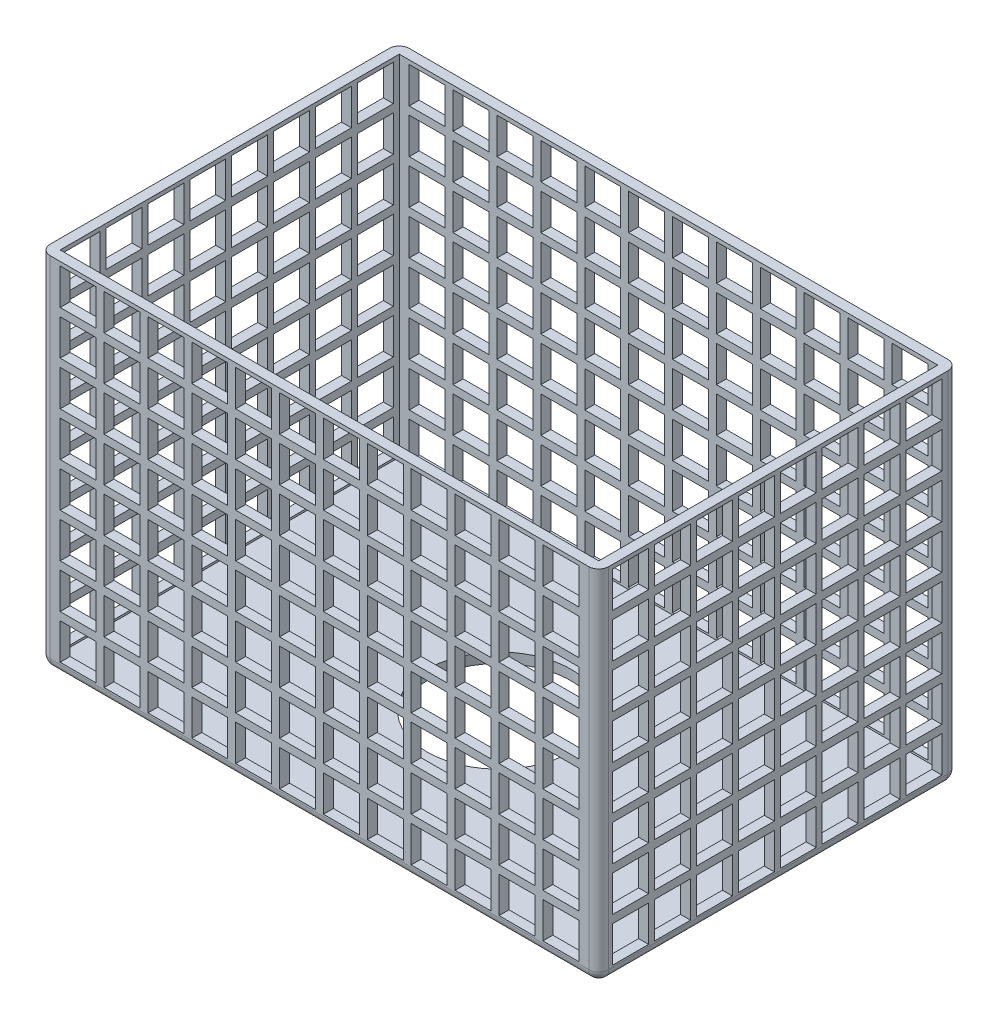
from build123d import *

# Parameters (mm, degrees)
SKETCH_1_W          = 280
SKETCH_1_H          = 180
EXTRUDE_1_DEPTH     = 180
FILLET_1_R          = 5
SHELL_START         = -135
SHELL_1_OUTLINE_W   = 175
SHELL_1_OUTLINE_H   = 170
SHELL_1_DEPTH       = 270
SKETCH_4_W          = 18
SKETCH_4_H          = 18
CUT_EXTRUDE_3_DEPTH = 246.153013443
SKETCH_5_W          = 18
SKETCH_5_H          = 18
CUT_EXTRUDE_4_DEPTH = 345.818792991
SKETCH_6_R          = 36
CUT_EXTRUDE_5_DEPTH = 288.445647036


# Read off the part's stored shape, not the designer's step: 抽壳1
with BuildPart() as part:
    # 草图1 → 凸台-拉伸1 (new body)
    with BuildSketch(Plane.XY):
        Rectangle(SKETCH_1_W, SKETCH_1_H)
    extrude(amount=EXTRUDE_1_DEPTH)

    # 圆角1
    fillet_1_edges = [part.edges().sort_by_distance(p)[0] for p in [
        (-140, 0, 180),
        (0, -90, 180),
        (140, 0, 180),
        (0, -90, 0),
        (-140, 0, 0),
        (140, 0, 0),
        (140, -90, 90),
        (-140, -90, 90),
    ]]
    fillet(fillet_1_edges, radius=FILLET_1_R)

    # 抽壳1 outline → 抽壳1 (cut)
    with BuildSketch(Plane.YZ.offset(SHELL_START)):
        with Locations((2.5, 90)):
            Rectangle(SHELL_1_OUTLINE_W, SHELL_1_OUTLINE_H)
    extrude(amount=SHELL_1_DEPTH, mode=Mode.SUBTRACT)

    # 草图4 → 切除-拉伸3 (cut, through all)
    with BuildSketch(Plane(origin=(0, 0, 0), x_dir=(-1, 0, 0), z_dir=(0, 0, -1))):
        with Locations((-121, 79)):
            Rectangle(SKETCH_4_W, SKETCH_4_H)
        with Locations((-99, 79)):
            Rectangle(SKETCH_4_W, SKETCH_4_H)
        with Locations((-77, 79)):
            Rectangle(SKETCH_4_W, SKETCH_4_H)
        with Locations((-55, 79)):
            Rectangle(SKETCH_4_W, SKETCH_4_H)
        with Locations((-33, 79)):
            Rectangle(SKETCH_4_W, SKETCH_4_H)
        with Locations((-11, 79)):
            Rectangle(SKETCH_4_W, SKETCH_4_H)
        with Locations((11, 79)):
            Rectangle(SKETCH_4_W, SKETCH_4_H)
        with Locations((33, 79)):
            Rectangle(SKETCH_4_W, SKETCH_4_H)
        with Locations((55, 79)):
            Rectangle(SKETCH_4_W, SKETCH_4_H)
        with Locations((77, 79)):
            Rectangle(SKETCH_4_W, SKETCH_4_H)
        with Locations((99, 79)):
            Rectangle(SKETCH_4_W, SKETCH_4_H)
        with Locations((121, 79)):
            Rectangle(SKETCH_4_W, SKETCH_4_H)
        with Locations((-99, 57)):
            Rectangle(SKETCH_4_W, SKETCH_4_H)
        with Locations((-77, 57)):
            Rectangle(SKETCH_4_W, SKETCH_4_H)
        with Locations((-55, 57)):
            Rectangle(SKETCH_4_W, SKETCH_4_H)
        with Locations((-33, 57)):
            Rectangle(SKETCH_4_W, SKETCH_4_H)
        with Locations((-11, 57)):
            Rectangle(SKETCH_4_W, SKETCH_4_H)
        with Locations((11, 57)):
            Rectangle(SKETCH_4_W, SKETCH_4_H)
        with Locations((33, 57)):
            Rectangle(SKETCH_4_W, SKETCH_4_H)
        with Locations((55, 57)):
            Rectangle(SKETCH_4_W, SKETCH_4_H)
        with Locations((77, 57)):
            Rectangle(SKETCH_4_W, SKETCH_4_H)
        with Locations((99, 57)):
            Rectangle(SKETCH_4_W, SKETCH_4_H)
        with Locations((121, 57)):
            Rectangle(SKETCH_4_W, SKETCH_4_H)
        with Locations((-99, 35)):
            Rectangle(SKETCH_4_W, SKETCH_4_H)
        with Locations((-77, 35)):
            Rectangle(SKETCH_4_W, SKETCH_4_H)
        with Locations((-55, 35)):
            Rectangle(SKETCH_4_W, SKETCH_4_H)
        with Locations((-33, 35)):
            Rectangle(SKETCH_4_W, SKETCH_4_H)
        with Locations((-11, 35)):
            Rectangle(SKETCH_4_W, SKETCH_4_H)
        with Locations((11, 35)):
            Rectangle(SKETCH_4_W, SKETCH_4_H)
        with Locations((33, 35)):
            Rectangle(SKETCH_4_W, SKETCH_4_H)
        with Locations((55, 35)):
            Rectangle(SKETCH_4_W, SKETCH_4_H)
        with Locations((77, 35)):
            Rectangle(SKETCH_4_W, SKETCH_4_H)
        with Locations((99, 35)):
            Rectangle(SKETCH_4_W, SKETCH_4_H)
        with Locations((121, 35)):
            Rectangle(SKETCH_4_W, SKETCH_4_H)
        with Locations((-99, 13)):
            Rectangle(SKETCH_4_W, SKETCH_4_H)
        with Locations((-77, 13)):
            Rectangle(SKETCH_4_W, SKETCH_4_H)
        with Locations((-55, 13)):
            Rectangle(SKETCH_4_W, SKETCH_4_H)
        with Locations((-33, 13)):
            Rectangle(SKETCH_4_W, SKETCH_4_H)
        with Locations((-11, 13)):
            Rectangle(SKETCH_4_W, SKETCH_4_H)
        with Locations((11, 13)):
            Rectangle(SKETCH_4_W, SKETCH_4_H)
        with Locations((33, 13)):
            Rectangle(SKETCH_4_W, SKETCH_4_H)
        with Locations((55, 13)):
            Rectangle(SKETCH_4_W, SKETCH_4_H)
        with Locations((77, 13)):
            Rectangle(SKETCH_4_W, SKETCH_4_H)
        with Locations((99, 13)):
            Rectangle(SKETCH_4_W, SKETCH_4_H)
        with Locations((121, 13)):
            Rectangle(SKETCH_4_W, SKETCH_4_H)
        with Locations((-99, -9)):
            Rectangle(SKETCH_4_W, SKETCH_4_H)
        with Locations((-77, -9)):
            Rectangle(SKETCH_4_W, SKETCH_4_H)
        with Locations((-55, -9)):
            Rectangle(SKETCH_4_W, SKETCH_4_H)
        with Locations((-33, -9)):
            Rectangle(SKETCH_4_W, SKETCH_4_H)
        with Locations((-11, -9)):
            Rectangle(SKETCH_4_W, SKETCH_4_H)
        with Locations((11, -9)):
            Rectangle(SKETCH_4_W, SKETCH_4_H)
        with Locations((33, -9)):
            Rectangle(SKETCH_4_W, SKETCH_4_H)
        with Locations((55, -9)):
            Rectangle(SKETCH_4_W, SKETCH_4_H)
        with Locations((77, -9)):
            Rectangle(SKETCH_4_W, SKETCH_4_H)
        with Locations((99, -9)):
            Rectangle(SKETCH_4_W, SKETCH_4_H)
        with Locations((121, -9)):
            Rectangle(SKETCH_4_W, SKETCH_4_H)
        with Locations((-99, -31)):
            Rectangle(SKETCH_4_W, SKETCH_4_H)
        with Locations((-77, -31)):
            Rectangle(SKETCH_4_W, SKETCH_4_H)
        with Locations((-55, -31)):
            Rectangle(SKETCH_4_W, SKETCH_4_H)
        with Locations((-33, -31)):
            Rectangle(SKETCH_4_W, SKETCH_4_H)
        with Locations((-11, -31)):
            Rectangle(SKETCH_4_W, SKETCH_4_H)
        with Locations((11, -31)):
            Rectangle(SKETCH_4_W, SKETCH_4_H)
        with Locations((33, -31)):
            Rectangle(SKETCH_4_W, SKETCH_4_H)
        with Locations((55, -31)):
            Rectangle(SKETCH_4_W, SKETCH_4_H)
        with Locations((77, -31)):
            Rectangle(SKETCH_4_W, SKETCH_4_H)
        with Locations((99, -31)):
            Rectangle(SKETCH_4_W, SKETCH_4_H)
        with Locations((121, -31)):
            Rectangle(SKETCH_4_W, SKETCH_4_H)
        with Locations((-99, -53)):
            Rectangle(SKETCH_4_W, SKETCH_4_H)
        with Locations((-77, -53)):
            Rectangle(SKETCH_4_W, SKETCH_4_H)
        with Locations((-55, -53)):
            Rectangle(SKETCH_4_W, SKETCH_4_H)
        with Locations((-33, -53)):
            Rectangle(SKETCH_4_W, SKETCH_4_H)
        with Locations((-11, -53)):
            Rectangle(SKETCH_4_W, SKETCH_4_H)
        with Locations((11, -53)):
            Rectangle(SKETCH_4_W, SKETCH_4_H)
        with Locations((33, -53)):
            Rectangle(SKETCH_4_W, SKETCH_4_H)
        with Locations((55, -53)):
            Rectangle(SKETCH_4_W, SKETCH_4_H)
        with Locations((77, -53)):
            Rectangle(SKETCH_4_W, SKETCH_4_H)
        with Locations((99, -53)):
            Rectangle(SKETCH_4_W, SKETCH_4_H)
        with Locations((121, -53)):
            Rectangle(SKETCH_4_W, SKETCH_4_H)
        with Locations((-99, -75)):
            Rectangle(SKETCH_4_W, SKETCH_4_H)
        with Locations((-77, -75)):
            Rectangle(SKETCH_4_W, SKETCH_4_H)
        with Locations((-55, -75)):
            Rectangle(SKETCH_4_W, SKETCH_4_H)
        with Locations((-33, -75)):
            Rectangle(SKETCH_4_W, SKETCH_4_H)
        with Locations((-11, -75)):
            Rectangle(SKETCH_4_W, SKETCH_4_H)
        with Locations((11, -75)):
            Rectangle(SKETCH_4_W, SKETCH_4_H)
        with Locations((33, -75)):
            Rectangle(SKETCH_4_W, SKETCH_4_H)
        with Locations((55, -75)):
            Rectangle(SKETCH_4_W, SKETCH_4_H)
        with Locations((77, -75)):
            Rectangle(SKETCH_4_W, SKETCH_4_H)
        with Locations((99, -75)):
            Rectangle(SKETCH_4_W, SKETCH_4_H)
        with Locations((121, -75)):
            Rectangle(SKETCH_4_W, SKETCH_4_H)
        with Locations((-121, 57)):
            Rectangle(SKETCH_4_W, SKETCH_4_H)
        with Locations((-121, 35)):
            Rectangle(SKETCH_4_W, SKETCH_4_H)
        with Locations((-121, 13)):
            Rectangle(SKETCH_4_W, SKETCH_4_H)
        with Locations((-121, -9)):
            Rectangle(SKETCH_4_W, SKETCH_4_H)
        with Locations((-121, -31)):
            Rectangle(SKETCH_4_W, SKETCH_4_H)
        with Locations((-121, -53)):
            Rectangle(SKETCH_4_W, SKETCH_4_H)
        with Locations((-121, -75)):
            Rectangle(SKETCH_4_W, SKETCH_4_H)
    extrude(amount=-CUT_EXTRUDE_3_DEPTH, mode=Mode.SUBTRACT)

    # 草图5 → 切除-拉伸4 (cut, through all)
    with BuildSketch(Plane(origin=(140, 0, 0), x_dir=(0, 0, -1), z_dir=(1, 0, 0))):
        with Locations((-164, 79)):
            Rectangle(SKETCH_5_W, SKETCH_5_H)
        with Locations((-143, 79)):
            Rectangle(SKETCH_5_W, SKETCH_5_H)
        with Locations((-122, 79)):
            Rectangle(SKETCH_5_W, SKETCH_5_H)
        with Locations((-101, 79)):
            Rectangle(SKETCH_5_W, SKETCH_5_H)
        with Locations((-80, 79)):
            Rectangle(SKETCH_5_W, SKETCH_5_H)
        with Locations((-59, 79)):
            Rectangle(SKETCH_5_W, SKETCH_5_H)
        with Locations((-38, 79)):
            Rectangle(SKETCH_5_W, SKETCH_5_H)
        with Locations((-17, 79)):
            Rectangle(SKETCH_5_W, SKETCH_5_H)
        with Locations((-143, 57)):
            Rectangle(SKETCH_5_W, SKETCH_5_H)
        with Locations((-122, 57)):
            Rectangle(SKETCH_5_W, SKETCH_5_H)
        with Locations((-101, 57)):
            Rectangle(SKETCH_5_W, SKETCH_5_H)
        with Locations((-80, 57)):
            Rectangle(SKETCH_5_W, SKETCH_5_H)
        with Locations((-59, 57)):
            Rectangle(SKETCH_5_W, SKETCH_5_H)
        with Locations((-38, 57)):
            Rectangle(SKETCH_5_W, SKETCH_5_H)
        with Locations((-17, 57)):
            Rectangle(SKETCH_5_W, SKETCH_5_H)
        with Locations((-143, 35)):
            Rectangle(SKETCH_5_W, SKETCH_5_H)
        with Locations((-122, 35)):
            Rectangle(SKETCH_5_W, SKETCH_5_H)
        with Locations((-101, 35)):
            Rectangle(SKETCH_5_W, SKETCH_5_H)
        with Locations((-80, 35)):
            Rectangle(SKETCH_5_W, SKETCH_5_H)
        with Locations((-59, 35)):
            Rectangle(SKETCH_5_W, SKETCH_5_H)
        with Locations((-38, 35)):
            Rectangle(SKETCH_5_W, SKETCH_5_H)
        with Locations((-17, 35)):
            Rectangle(SKETCH_5_W, SKETCH_5_H)
        with Locations((-143, 13)):
            Rectangle(SKETCH_5_W, SKETCH_5_H)
        with Locations((-122, 13)):
            Rectangle(SKETCH_5_W, SKETCH_5_H)
        with Locations((-101, 13)):
            Rectangle(SKETCH_5_W, SKETCH_5_H)
        with Locations((-80, 13)):
            Rectangle(SKETCH_5_W, SKETCH_5_H)
        with Locations((-59, 13)):
            Rectangle(SKETCH_5_W, SKETCH_5_H)
        with Locations((-38, 13)):
            Rectangle(SKETCH_5_W, SKETCH_5_H)
        with Locations((-17, 13)):
            Rectangle(SKETCH_5_W, SKETCH_5_H)
        with Locations((-143, -9)):
            Rectangle(SKETCH_5_W, SKETCH_5_H)
        with Locations((-122, -9)):
            Rectangle(SKETCH_5_W, SKETCH_5_H)
        with Locations((-101, -9)):
            Rectangle(SKETCH_5_W, SKETCH_5_H)
        with Locations((-80, -9)):
            Rectangle(SKETCH_5_W, SKETCH_5_H)
        with Locations((-59, -9)):
            Rectangle(SKETCH_5_W, SKETCH_5_H)
        with Locations((-38, -9)):
            Rectangle(SKETCH_5_W, SKETCH_5_H)
        with Locations((-17, -9)):
            Rectangle(SKETCH_5_W, SKETCH_5_H)
        with Locations((-143, -31)):
            Rectangle(SKETCH_5_W, SKETCH_5_H)
        with Locations((-122, -31)):
            Rectangle(SKETCH_5_W, SKETCH_5_H)
        with Locations((-101, -31)):
            Rectangle(SKETCH_5_W, SKETCH_5_H)
        with Locations((-80, -31)):
            Rectangle(SKETCH_5_W, SKETCH_5_H)
        with Locations((-59, -31)):
            Rectangle(SKETCH_5_W, SKETCH_5_H)
        with Locations((-38, -31)):
            Rectangle(SKETCH_5_W, SKETCH_5_H)
        with Locations((-17, -31)):
            Rectangle(SKETCH_5_W, SKETCH_5_H)
        with Locations((-143, -53)):
            Rectangle(SKETCH_5_W, SKETCH_5_H)
        with Locations((-122, -53)):
            Rectangle(SKETCH_5_W, SKETCH_5_H)
        with Locations((-101, -53)):
            Rectangle(SKETCH_5_W, SKETCH_5_H)
        with Locations((-80, -53)):
            Rectangle(SKETCH_5_W, SKETCH_5_H)
        with Locations((-59, -53)):
            Rectangle(SKETCH_5_W, SKETCH_5_H)
        with Locations((-38, -53)):
            Rectangle(SKETCH_5_W, SKETCH_5_H)
        with Locations((-17, -53)):
            Rectangle(SKETCH_5_W, SKETCH_5_H)
        with Locations((-143, -75)):
            Rectangle(SKETCH_5_W, SKETCH_5_H)
        with Locations((-122, -75)):
            Rectangle(SKETCH_5_W, SKETCH_5_H)
        with Locations((-101, -75)):
            Rectangle(SKETCH_5_W, SKETCH_5_H)
        with Locations((-80, -75)):
            Rectangle(SKETCH_5_W, SKETCH_5_H)
        with Locations((-59, -75)):
            Rectangle(SKETCH_5_W, SKETCH_5_H)
        with Locations((-38, -75)):
            Rectangle(SKETCH_5_W, SKETCH_5_H)
        with Locations((-17, -75)):
            Rectangle(SKETCH_5_W, SKETCH_5_H)
        with Locations((-164, 57)):
            Rectangle(SKETCH_5_W, SKETCH_5_H)
        with Locations((-164, 35)):
            Rectangle(SKETCH_5_W, SKETCH_5_H)
        with Locations((-164, 13)):
            Rectangle(SKETCH_5_W, SKETCH_5_H)
        with Locations((-164, -9)):
            Rectangle(SKETCH_5_W, SKETCH_5_H)
        with Locations((-164, -31)):
            Rectangle(SKETCH_5_W, SKETCH_5_H)
        with Locations((-164, -53)):
            Rectangle(SKETCH_5_W, SKETCH_5_H)
        with Locations((-164, -75)):
            Rectangle(SKETCH_5_W, SKETCH_5_H)
    extrude(amount=-CUT_EXTRUDE_4_DEPTH, mode=Mode.SUBTRACT)

    # 草图6 → 切除-拉伸5 (cut, through all)
    with BuildSketch(Plane(origin=(0, -85, 0), x_dir=(1, 0, 0), z_dir=(0, 1, 0))):
        with Locations(Location((0, -90, 0), (0, 0, 270))):
            Circle(SKETCH_6_R)
    extrude(amount=-CUT_EXTRUDE_5_DEPTH, mode=Mode.SUBTRACT)


solid = part.part
